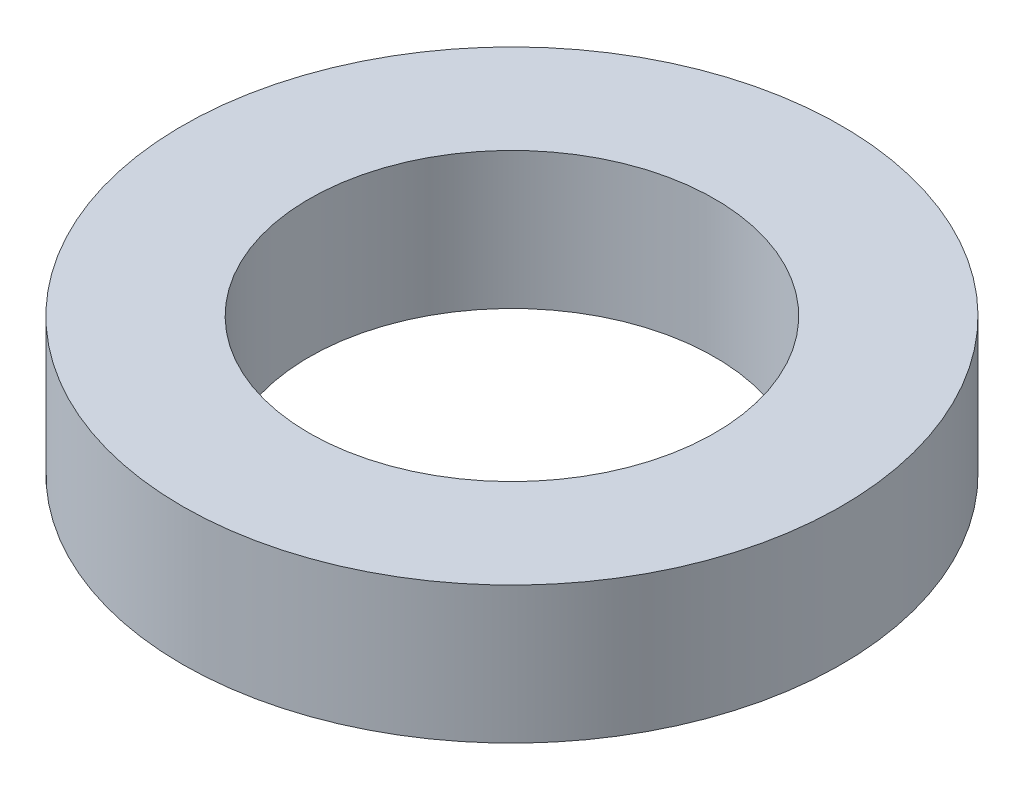
from build123d import *

# Parameters (mm, degrees)
SKETCH1_R           = 65
BOSS_EXTRUDE1_DEPTH = 27
SKETCH2_R           = 40
CUT_EXTRUDE1_DEPTH  = 96.807097858


with BuildPart() as part:
    # Sketch1 → Boss-Extrude1 (new body)
    with BuildSketch(Plane(origin=(0, 0, 0), x_dir=(1, 0, 0), z_dir=(0, 1, 0))):
        Circle(SKETCH1_R)
    extrude(amount=BOSS_EXTRUDE1_DEPTH)

    # Sketch2 → Cut-Extrude1 (cut, through all)
    with BuildSketch(Plane(origin=(0, 0, 0), x_dir=(1, 0, 0), z_dir=(0, 1, 0))):
        Circle(SKETCH2_R)
    extrude(amount=CUT_EXTRUDE1_DEPTH, mode=Mode.SUBTRACT)


solid = part.part
